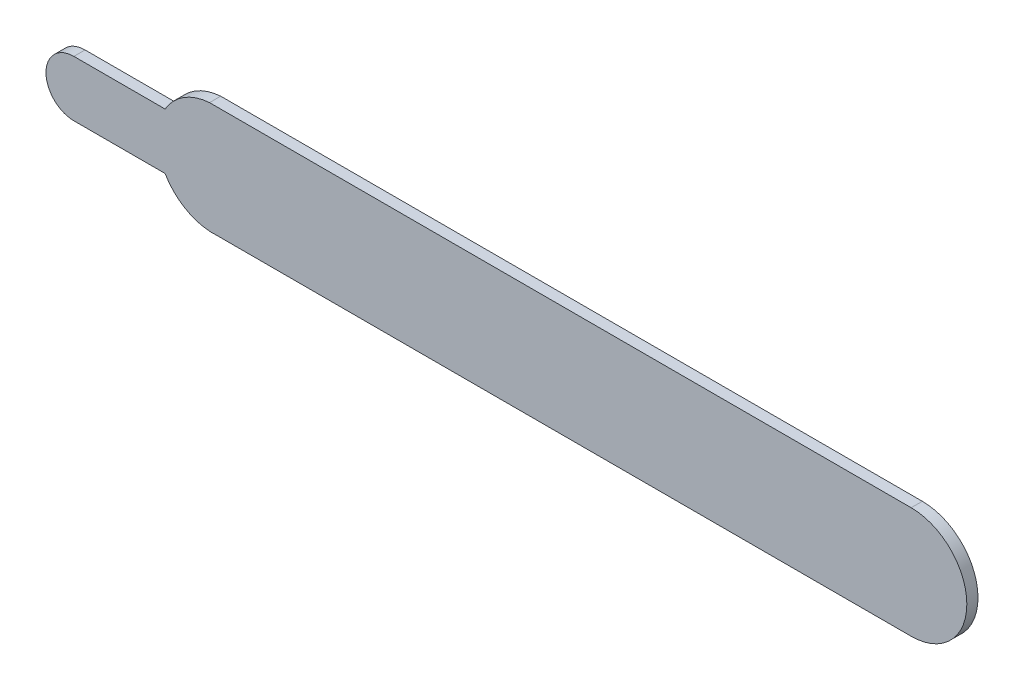
from build123d import *

# Parameters (mm, degrees)
BOSS_EXTRUDE1_DEPTH = 1


with BuildPart() as part:
    # Sketch1 → Boss-Extrude1 (new, symmetric)
    with BuildSketch(Plane.XY):
        with BuildLine():
            Line((-0.703311289, 9.975237001), (125, 9.974443058))
            ThreePointArc((125, 9.974443058), (134.974439842, 0.008009605), (125.016019204, -9.974430194))
            Line((125.016019204, -9.974430194), (0.725535615, -9.973645175))
            ThreePointArc((0.725535615, -9.973645175), (-4.682331224, -8.8360497), (-8.660254038, -5))
            Line((-8.660254038, -5), (-25, -5))
            ThreePointArc((-25, -5), (-30, 0), (-25, 5))
            Line((-25, 5), (-8.660254038, 5))
            ThreePointArc((-8.660254038, 5), (-5.301635098, 8.478954257), (-0.703311289, 9.975237001))
        make_face()
    extrude(amount=BOSS_EXTRUDE1_DEPTH, both=True)


solid = part.part
